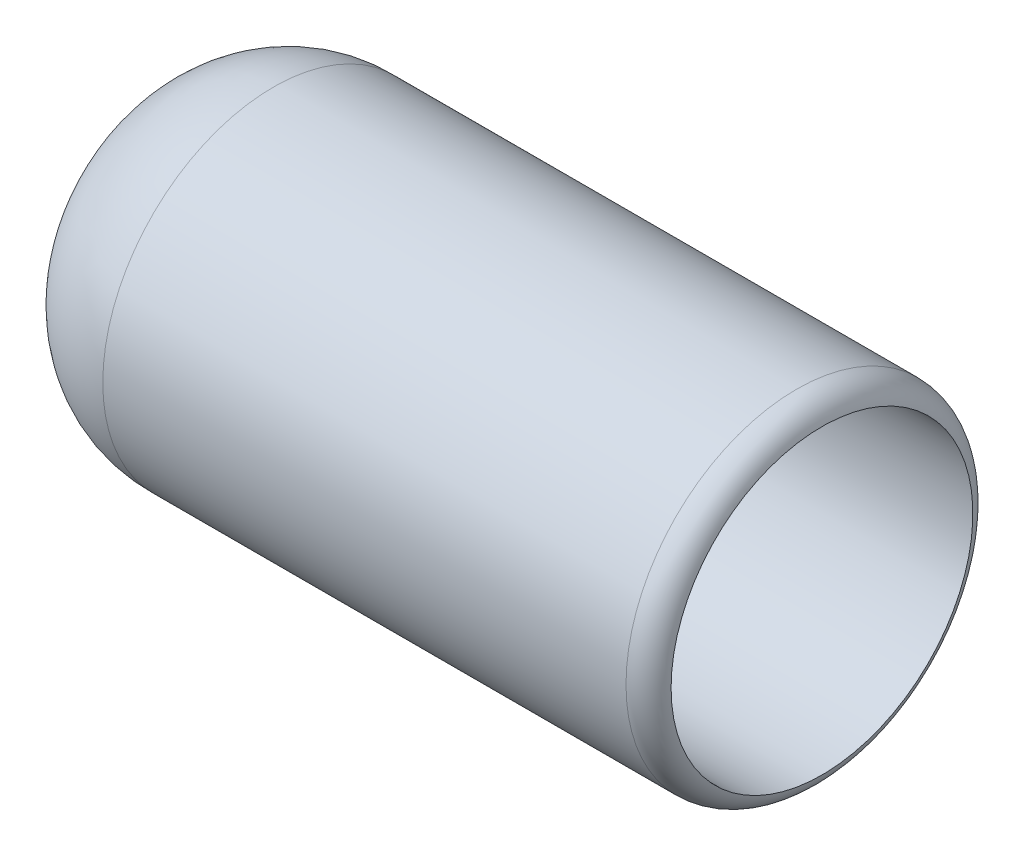
from build123d import *

# Parameters (mm, degrees)
FILLET2_R = 2


with BuildPart() as part:
    # Sketch1 → Revolve1 (revolve)
    with BuildSketch(Plane.XY, mode=Mode.PRIVATE) as revolve1_sk:
        with BuildLine():
            Line((8.184829328, 13), (50, 13))
            Line((50, 13), (50, 11.5))
            Line((50, 11.5), (8.184829328, 11.5))
            ThreePointArc((8.184829328, 11.5), (3.610716754, 10.486929027), (0, 7.50170824))
            Line((0, 7.50170824), (0, 9.00170824))
            ThreePointArc((0, 9.00170824), (3.610716754, 11.986929027), (8.184829328, 13))
        make_face()
    revolve(revolve1_sk.sketch.rotate(Axis((0, 0, 0), (1, 0, 0)), 90), axis=Axis((0, 0, 0), (1, 0, 0)))

    # Fillet2
    # the kernel refuses this fillet: 2 mm, written as the material it takes off along each edge
    with BuildSketch(Plane(origin=(50, 0, 0), x_dir=(0, 0, 1), z_dir=(0, 1, 0))) as fillet2_piece_1:
        with BuildLine():
            CenterArc((11, -1.936491673), FILLET2_R, 0, 75.522487814)
            Line((11.5, 0), (11.51, 0.038729833))
            ThreePointArc((11.51, 0.038729833), (12.25, 0.04), (13, 0.04))
            Line((13, 0.04), (13.04, 0))
            Line((13.04, 0), (13.04, -1.936491673))
            Line((13.04, -1.936491673), (13, -1.936491673))
        make_face()
    revolve(axis=Axis((50, 0, 0), (1, 0, 0)), mode=Mode.SUBTRACT)


solid = part.part
